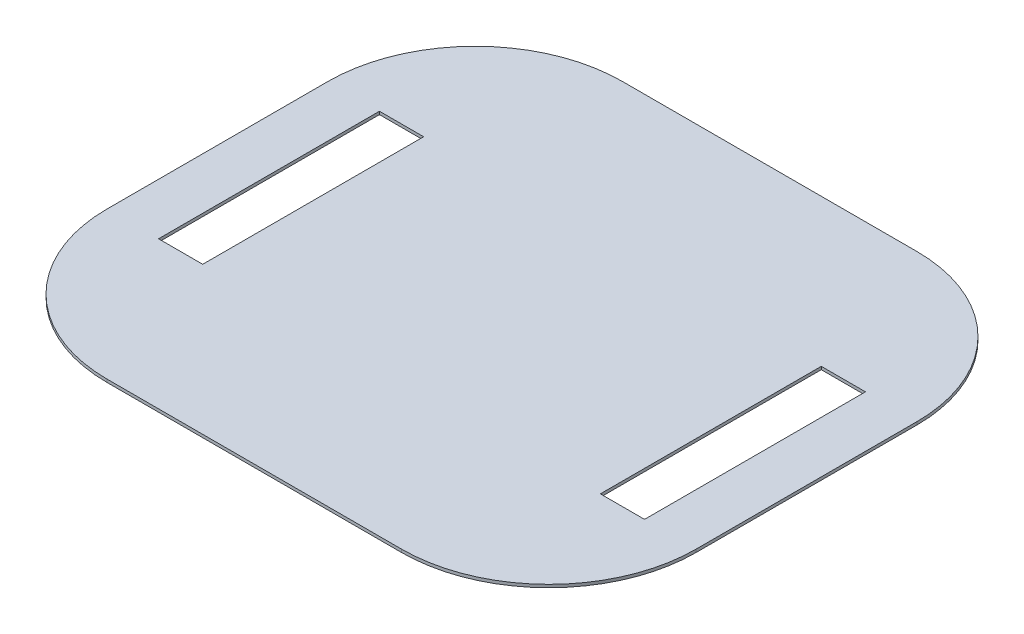
from build123d import *

# Parameters (mm, degrees)
SKETCH2_W           = 400
SKETCH2_H           = 350
BASE_FLANGE1_DEPTH  = 2
CUT_EXTRUDE1_REACH  = 267.761
SKETCH7_W           = 30
SKETCH7_H           = 150
BREAK_CORNER1_DEPTH = 2


# Read off the part's stored shape, not the designer's step: Break-Corner1
# Sheet-metal steps are written as plain solids
with BuildPart() as part:
    # Sketch2 → Base-Flange1 (new body)
    with BuildSketch(Plane(origin=(0, 0, 0), x_dir=(1, 0, 0), z_dir=(0, 1, 0))):
        Rectangle(SKETCH2_W, SKETCH2_H)
    extrude(amount=BASE_FLANGE1_DEPTH)

    # Sketch7 → Cut-Extrude1 (cut, up to next)
    with BuildSketch(Plane(origin=(0, 2, 0), x_dir=(1, 0, 0), z_dir=(0, 1, 0)), mode=Mode.PRIVATE) as cut_extrude1_sk1:
        with Locations((-150, 0)):
            Rectangle(SKETCH7_W, SKETCH7_H)
    cut_extrude1_tool1 = extrude(cut_extrude1_sk1.sketch, amount=-CUT_EXTRUDE1_REACH, mode=Mode.PRIVATE) & part.part
    # Sketch7 → Cut-Extrude1 (cut, up to next)
    with BuildSketch(Plane(origin=(0, 2, 0), x_dir=(1, 0, 0), z_dir=(0, 1, 0)), mode=Mode.PRIVATE) as cut_extrude1_sk2:
        with Locations((150, 0)):
            Rectangle(SKETCH7_W, SKETCH7_H)
    cut_extrude1_tool2 = extrude(cut_extrude1_sk2.sketch, amount=-CUT_EXTRUDE1_REACH, mode=Mode.PRIVATE) & part.part
    add(cut_extrude1_tool1.solids().sort_by_distance((-150, 2, 0))[0], mode=Mode.SUBTRACT)
    add(cut_extrude1_tool2.solids().sort_by_distance((150, 2, 0))[0], mode=Mode.SUBTRACT)

    # Break-Corner1 outline → Break-Corner1 (cut)
    with BuildSketch(Plane(origin=(0, 0, 0), x_dir=(1, 0, 0), z_dir=(0, 1, 0))):
        with BuildLine():
            Line((-200, 175), (-200, 75))
            ThreePointArc((-200, 75), (-170.710678119, 145.710678119), (-100, 175))
            Line((-100, 175), (-200, 175))
        make_face()
        with BuildLine():
            ThreePointArc((-100, -175), (-170.710678119, -145.710678119), (-200, -75))
            Line((-200, -75), (-200, -175))
            Line((-200, -175), (-100, -175))
        make_face()
        with BuildLine():
            Line((200, 175), (100, 175))
            ThreePointArc((100, 175), (170.710678119, 145.710678119), (200, 75))
            Line((200, 75), (200, 175))
        make_face()
        with BuildLine():
            ThreePointArc((200, -75), (170.710678119, -145.710678119), (100, -175))
            Line((100, -175), (200, -175))
            Line((200, -175), (200, -75))
        make_face()
    extrude(amount=BREAK_CORNER1_DEPTH, mode=Mode.SUBTRACT)


solid = part.part
